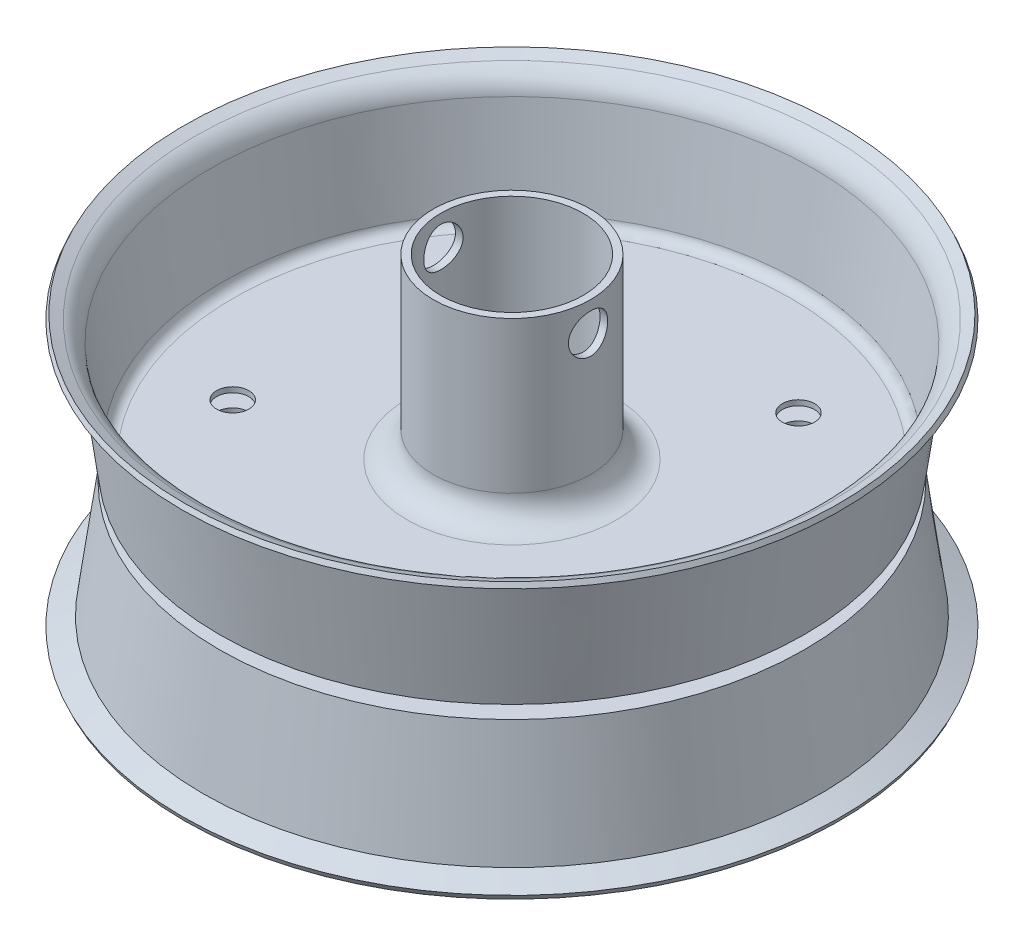
from build123d import *

# Parameters (mm, degrees)
SKETCH1_R                      = 19.05
SKETCH1_R_2                    = 17.272
BOSS_EXTRUDE1_DEPTH            = 73.152
FILLET1_R                      = 6.35
FILLET2_R                      = 2.54
FILLET3_R                      = 6.35
CUT_EXTRUDE1_REACH             = 122.908
SKETCH2_R                      = 3.9
FILLET1_OF_MIRROR1_R           = 6.35
FILLET2_OF_MIRROR1_R           = 2.54
FILLET3_OF_MIRROR1_R           = 6.35
CUT_EXTRUDE2_REACH             = 136.597
SKETCH4_R                      = 4.7625
CUT_EXTRUDE2_DIRECTION_2_REACH = 136.597


with BuildPart() as part:
    # Sketch1 → Boss-Extrude1 (new body)
    with BuildSketch(Plane(origin=(0, 0, 0), x_dir=(1, 0, 0), z_dir=(0, 1, 0))):
        Circle(SKETCH1_R)
        Circle(SKETCH1_R_2, mode=Mode.SUBTRACT)
    extrude(amount=BOSS_EXTRUDE1_DEPTH)

    # Sketch3 → Revolve1 (revolve)
    with BuildSketch(Plane(origin=(0, 0, 0), x_dir=(0, 0, -1), z_dir=(1, 0, 0))):
        Polygon((-19.05, 30.099), (-69.85, 30.099), (-73.66, 58.039), (-79.375, 60.579), (-79.890795852, 59.418459333), (-74.822704503, 57.165974289), (-70.958571646, 28.829), (-19.05, 28.829), align=None)
    revolve1 = revolve(axis=Axis((0, 73.152, 0), (0, -1, 0)))

    # Fillet1
    fillet1_edges = [part.edges().sort_by_distance(p)[0] for p in [
        (-19.05, 30.099, 0),
    ]]
    fillet(fillet1_edges, radius=FILLET1_R)

    # Fillet2
    fillet2_edges = [part.edges().sort_by_distance(p)[0] for p in [
        (0, 30.099, -69.85),
    ]]
    fillet(fillet2_edges, radius=FILLET2_R)

    # Fillet3
    fillet3_edges = [part.edges().sort_by_distance(p)[0] for p in [
        (0, 58.039, -73.66),
    ]]
    fillet(fillet3_edges, radius=FILLET3_R)

    # Sketch2 → Cut-Extrude1 (cut, up to next)
    with BuildSketch(Plane(origin=(0, 30.099, 0), x_dir=(1, 0, 0), z_dir=(0, 1, 0)), mode=Mode.PRIVATE) as cut_extrude1_sk1:
        with Locations((-34.614825389, 37.48444822)):
            Circle(SKETCH2_R)
    cut_extrude1_tool1 = extrude(cut_extrude1_sk1.sketch, amount=-CUT_EXTRUDE1_REACH, mode=Mode.PRIVATE) & part.part
    # Sketch2 → Cut-Extrude1 (cut, up to next)
    with BuildSketch(Plane(origin=(0, 30.099, 0), x_dir=(1, 0, 0), z_dir=(0, 1, 0)), mode=Mode.PRIVATE) as cut_extrude1_sk2:
        with Locations((24.953259436, 44.503986772)):
            Circle(SKETCH2_R)
    cut_extrude1_tool2 = extrude(cut_extrude1_sk2.sketch, amount=-CUT_EXTRUDE1_REACH, mode=Mode.PRIVATE) & part.part
    # Sketch2 → Cut-Extrude1 (cut, up to next)
    with BuildSketch(Plane(origin=(0, 30.099, 0), x_dir=(1, 0, 0), z_dir=(0, 1, 0)), mode=Mode.PRIVATE) as cut_extrude1_sk3:
        with Locations((50.036787851, -9.97947176)):
            Circle(SKETCH2_R)
    cut_extrude1_tool3 = extrude(cut_extrude1_sk3.sketch, amount=-CUT_EXTRUDE1_REACH, mode=Mode.PRIVATE) & part.part
    # Sketch2 → Cut-Extrude1 (cut, up to next)
    with BuildSketch(Plane(origin=(0, 30.099, 0), x_dir=(1, 0, 0), z_dir=(0, 1, 0)), mode=Mode.PRIVATE) as cut_extrude1_sk4:
        with Locations((5.971176144, -50.671639509)):
            Circle(SKETCH2_R)
    cut_extrude1_tool4 = extrude(cut_extrude1_sk4.sketch, amount=-CUT_EXTRUDE1_REACH, mode=Mode.PRIVATE) & part.part
    # Sketch2 → Cut-Extrude1 (cut, up to next)
    with BuildSketch(Plane(origin=(0, 30.099, 0), x_dir=(1, 0, 0), z_dir=(0, 1, 0)), mode=Mode.PRIVATE) as cut_extrude1_sk5:
        with Locations((-46.346398042, -21.337323722)):
            Circle(SKETCH2_R)
    cut_extrude1_tool5 = extrude(cut_extrude1_sk5.sketch, amount=-CUT_EXTRUDE1_REACH, mode=Mode.PRIVATE) & part.part
    cut_extrude1_1 = cut_extrude1_tool1.solids().sort_by_distance((-34.614825, 30.099, -37.484448))[0]
    add(cut_extrude1_1, mode=Mode.SUBTRACT)
    cut_extrude1_2 = cut_extrude1_tool2.solids().sort_by_distance((24.953259, 30.099, -44.503987))[0]
    add(cut_extrude1_2, mode=Mode.SUBTRACT)
    cut_extrude1_3 = cut_extrude1_tool3.solids().sort_by_distance((50.036788, 30.099, 9.979472))[0]
    add(cut_extrude1_3, mode=Mode.SUBTRACT)
    cut_extrude1_4 = cut_extrude1_tool4.solids().sort_by_distance((5.971176, 30.099, 50.67164))[0]
    add(cut_extrude1_4, mode=Mode.SUBTRACT)
    cut_extrude1_5 = cut_extrude1_tool5.solids().sort_by_distance((-46.346398, 30.099, 21.337324))[0]
    add(cut_extrude1_5, mode=Mode.SUBTRACT)
    cut_extrude1 = cut_extrude1_1 + cut_extrude1_2 + cut_extrude1_3 + cut_extrude1_4 + cut_extrude1_5  # Cut-Extrude1 as one shape, for the pattern or mirror that repeats it

    # Mirror1: Revolve1, Cut-Extrude1 across plane
    add(revolve1.mirror(Plane(origin=(0, 27.2415, 0), x_dir=(0, 0, 1), z_dir=(0, -1, 0))))
    add(cut_extrude1.mirror(Plane(origin=(0, 27.2415, 0), x_dir=(0, 0, 1), z_dir=(0, -1, 0))), mode=Mode.SUBTRACT)

    # Fillet1 of Mirror1
    fillet1_of_mirror1_edges = [part.edges().sort_by_distance(p)[0] for p in [
        (-19.05, 24.384, 0),
    ]]
    fillet(fillet1_of_mirror1_edges, radius=FILLET1_OF_MIRROR1_R)

    # Fillet2 of Mirror1
    fillet2_of_mirror1_edges = [part.edges().sort_by_distance(p)[0] for p in [
        (0, 24.384, -69.85),
    ]]
    fillet(fillet2_of_mirror1_edges, radius=FILLET2_OF_MIRROR1_R)

    # Fillet3 of Mirror1
    fillet3_of_mirror1_edges = [part.edges().sort_by_distance(p)[0] for p in [
        (0, -3.556, -73.66),
    ]]
    fillet(fillet3_of_mirror1_edges, radius=FILLET3_OF_MIRROR1_R)

    # Sketch4 → Cut-Extrude2 (cut, up to next)
    with BuildSketch(Plane(origin=(0, 0, 0), x_dir=(0, 0, -1), z_dir=(1, 0, 0)), mode=Mode.PRIVATE) as cut_extrude2_sk1:
        with Locations((0, 66.04)):
            Circle(SKETCH4_R)
    cut_extrude2_tool1 = extrude(cut_extrude2_sk1.sketch, amount=-CUT_EXTRUDE2_REACH, mode=Mode.PRIVATE) & part.part
    # Sketch4 → Cut-Extrude2 (cut, up to next)
    with BuildSketch(Plane(origin=(0, 0, 0), x_dir=(0, 0, -1), z_dir=(1, 0, 0)), mode=Mode.PRIVATE) as cut_extrude2_sk2:
        with Locations((0, 10.16)):
            Circle(SKETCH4_R)
    cut_extrude2_tool2 = extrude(cut_extrude2_sk2.sketch, amount=-CUT_EXTRUDE2_REACH, mode=Mode.PRIVATE) & part.part
    add(cut_extrude2_tool1.solids().sort_by_distance((0, 66.04, 0))[0], mode=Mode.SUBTRACT)
    add(cut_extrude2_tool2.solids().sort_by_distance((0, 10.16, 0))[0], mode=Mode.SUBTRACT)

    # Sketch4 → Cut-Extrude2 direction 2 (cut, up to next)
    with BuildSketch(Plane(origin=(0, 0, 0), x_dir=(0, 0, -1), z_dir=(1, 0, 0)), mode=Mode.PRIVATE) as cut_extrude2_direction_2_sk1:
        with Locations((0, 66.04)):
            Circle(SKETCH4_R)
    cut_extrude2_direction_2_tool1 = extrude(cut_extrude2_direction_2_sk1.sketch, amount=CUT_EXTRUDE2_DIRECTION_2_REACH, mode=Mode.PRIVATE) & part.part
    # Sketch4 → Cut-Extrude2 direction 2 (cut, up to next)
    with BuildSketch(Plane(origin=(0, 0, 0), x_dir=(0, 0, -1), z_dir=(1, 0, 0)), mode=Mode.PRIVATE) as cut_extrude2_direction_2_sk2:
        with Locations((0, 10.16)):
            Circle(SKETCH4_R)
    cut_extrude2_direction_2_tool2 = extrude(cut_extrude2_direction_2_sk2.sketch, amount=CUT_EXTRUDE2_DIRECTION_2_REACH, mode=Mode.PRIVATE) & part.part
    add(cut_extrude2_direction_2_tool1.solids().sort_by_distance((0, 66.04, 0))[0], mode=Mode.SUBTRACT)
    add(cut_extrude2_direction_2_tool2.solids().sort_by_distance((0, 10.16, 0))[0], mode=Mode.SUBTRACT)


solid = part.part
